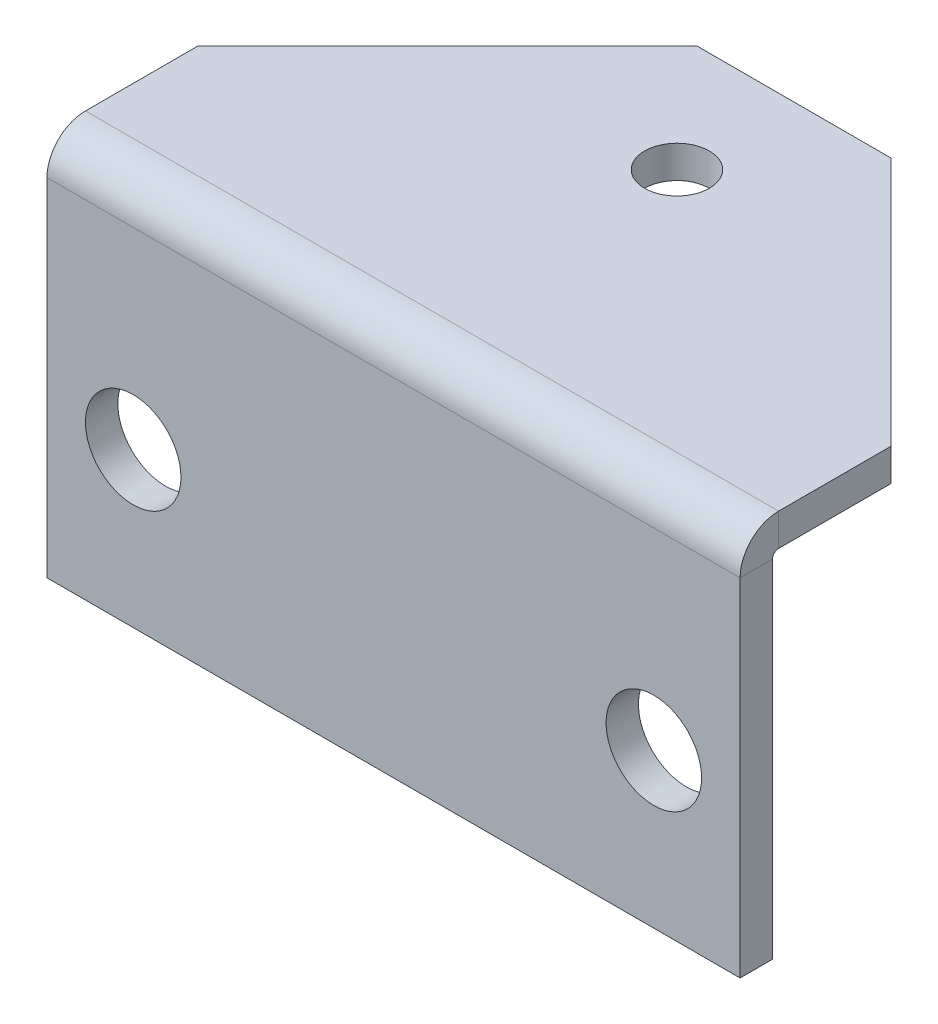
from build123d import *

# Parameters (mm, degrees)
CROQUIS1_W                       = 57.15
CROQUIS1_H                       = 31.75
BRIDA_BASE1_DEPTH                = 2.667
BRIDA_DE_ARISTA1_STRIP_W         = 11.684
BRIDA_DE_ARISTA1_STRIP_H         = 2.667
BRIDA_DE_ARISTA1_STRIP_CUT_DEPTH = 57.15
BRIDA_DE_ARISTA1_DEPTH           = 57.15
CROQUIS9_R                       = 3.937
CORTAR_EXTRUIR1_DEPTH            = 5.588
CROQUIS10_R                      = 2.667
CORTAR_EXTRUIR2_DEPTH            = 5.588


# Sheet-metal steps are written as plain solids
with BuildPart() as part:
    # Croquis1 → Brida base1 (new body)
    with BuildSketch(Plane.XY):
        Rectangle(CROQUIS1_W, CROQUIS1_H)
    extrude(amount=-BRIDA_BASE1_DEPTH)

    # Brida de arista1 strip (across the edge) → Brida de arista1 strip cut (cut)
    with BuildSketch(Plane(origin=(-28.575, 15.875, -2.667), x_dir=(0, -1, 0), z_dir=(1, 0, 0))):
        with Locations((-2.667, -1.3335)):
            Rectangle(BRIDA_DE_ARISTA1_STRIP_W, BRIDA_DE_ARISTA1_STRIP_H)
    extrude(amount=BRIDA_DE_ARISTA1_STRIP_CUT_DEPTH, mode=Mode.SUBTRACT)

    # Brida de arista1 section (across the edge) → Brida de arista1 (add)
    with BuildSketch(Plane(origin=(-28.575, 15.875, -2.667), x_dir=(0, -1, 0), z_dir=(1, 0, 0))):
        with BuildLine():
            Line((0, 0.508), (0, 30.353))
            Line((0, 30.353), (2.667, 30.353))
            Line((2.667, 30.353), (2.667, 0.508))
            ThreePointArc((2.667, 0.508), (2.815789755, 0.148789755), (3.175, 0))
            Line((3.175, 0), (3.175, -2.667))
            ThreePointArc((3.175, -2.667), (0.92993597, -1.73706403), (0, 0.508))
        make_face()
    extrude(amount=BRIDA_DE_ARISTA1_DEPTH)

    # Croquis9 → Cortar-Extruir1 (cut)
    with BuildSketch(Plane.XY):
        with Locations((-21.463, -3.175)):
            Circle(CROQUIS9_R)
        with Locations((21.463, -3.175)):
            Circle(CROQUIS9_R)
    extrude(amount=-CORTAR_EXTRUIR1_DEPTH, mode=Mode.SUBTRACT)

    # Croquis10 → Cortar-Extruir2 (cut)
    with BuildSketch(Plane(origin=(0, 15.875, 0), x_dir=(1, 0, 0), z_dir=(0, 1, 0))):
        with Locations(Location((0, 23.368, 0), (0, 0, 270))):
            Circle(CROQUIS10_R)
        Polygon((-28.575, 33.02), (-8.001, 33.02), (-28.575, 12.446), align=None)
        Polygon((28.575, 33.02), (8.001, 33.02), (28.575, 12.446), align=None)
    extrude(amount=-CORTAR_EXTRUIR2_DEPTH, mode=Mode.SUBTRACT)


solid = part.part
